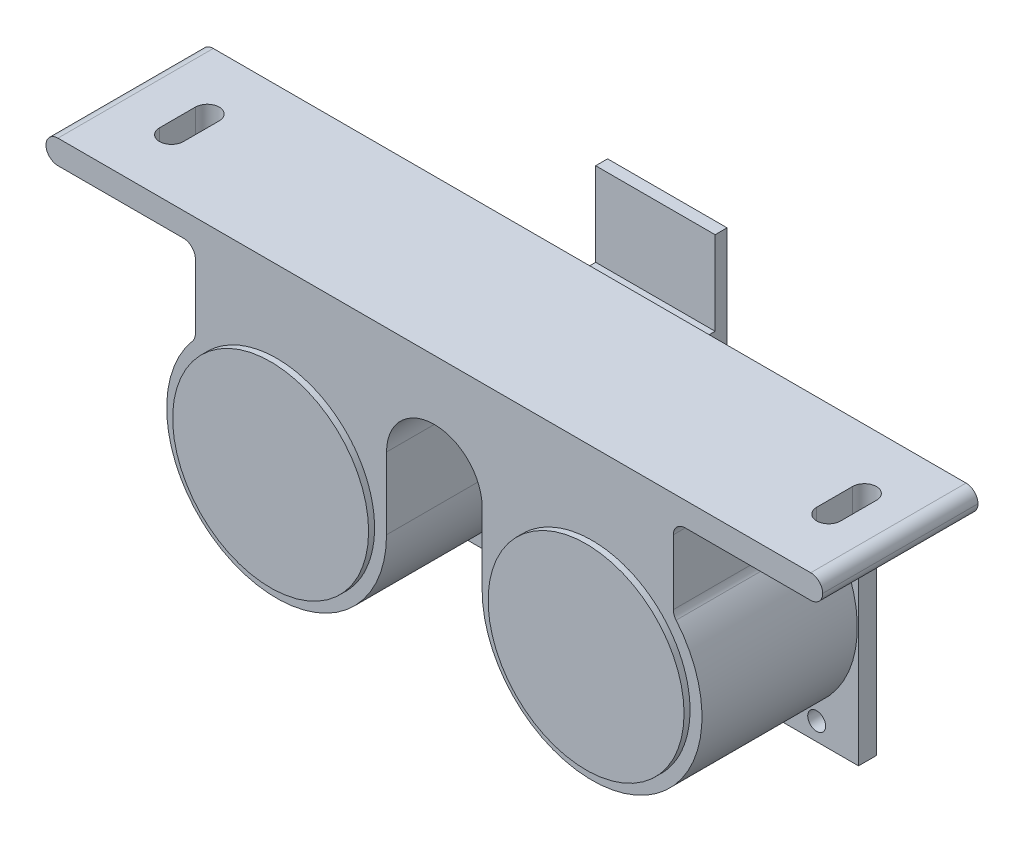
from build123d import *

# Parameters (mm, degrees)
SKETCH1_W           = 45
SKETCH1_H           = 20
SKETCH1_R           = 0.75
BOSS_EXTRUDE1_DEPTH = 1.5
SKETCH1_3_R         = 8.2
BOSS_EXTRUDE2_DEPTH = 13.5
SKETCH2_W           = 5
SKETCH2_H           = 4
SKETCH2_H_2         = 1
BOSS_EXTRUDE3_DEPTH = 3
SKETCH2_3_W         = 5
SKETCH2_3_H         = 1
BOSS_EXTRUDE4_DEPTH = 7
SKETCH4_R           = 8.2
BOSS_EXTRUDE5_DEPTH = 13
CUT_EXTRUDE1_DEPTH  = 2
FILLET1_R           = 1


with BuildPart() as part:
    # Sketch1 → Boss-Extrude1 (new body)
    with BuildSketch(Plane.XY):
        with Locations((22.5, 10)):
            Rectangle(SKETCH1_W, SKETCH1_H)
        with Locations((1.5, 1.5)):
            Circle(SKETCH1_R, mode=Mode.SUBTRACT)
        with Locations((1.5, 18.5)):
            Circle(SKETCH1_R, mode=Mode.SUBTRACT)
        with Locations((41.5, 18.5)):
            Circle(SKETCH1_R, mode=Mode.SUBTRACT)
        with Locations((41.5, 1.5)):
            Circle(SKETCH1_R, mode=Mode.SUBTRACT)
    extrude(amount=-BOSS_EXTRUDE1_DEPTH)

    # Sketch1<3> → Boss-Extrude2 (add)
    with BuildSketch(Plane.XY):
        with Locations((9.3, 10)):
            Circle(SKETCH1_3_R)
        with Locations((35.7, 10)):
            Circle(SKETCH1_3_R)
    extrude(amount=BOSS_EXTRUDE2_DEPTH)

    # Sketch2 → Boss-Extrude3 (add)
    with BuildSketch(Plane(origin=(0, 20, 0), x_dir=(1, 0, 0), z_dir=(0, 1, 0))):
        with Locations((25, 3.5)):
            Rectangle(SKETCH2_W, SKETCH2_H)
        with Locations((20, 3.5)):
            Rectangle(SKETCH2_W, SKETCH2_H)
        with Locations((20, 6)):
            Rectangle(SKETCH2_W, SKETCH2_H_2)
        with Locations((25, 6)):
            Rectangle(SKETCH2_W, SKETCH2_H_2)
    extrude(amount=-BOSS_EXTRUDE3_DEPTH)

    # Sketch2<3> → Boss-Extrude4 (add)
    with BuildSketch(Plane(origin=(0, 20, 0), x_dir=(1, 0, 0), z_dir=(0, 1, 0))):
        with Locations((25, 6)):
            Rectangle(SKETCH2_3_W, SKETCH2_3_H)
        with Locations((20, 6)):
            Rectangle(SKETCH2_3_W, SKETCH2_3_H)
    extrude(amount=BOSS_EXTRUDE4_DEPTH)


with BuildPart() as body_2:
    # Sketch4 → Boss-Extrude5 (new body)
    with BuildSketch(Plane.XY):
        with BuildLine():
            Line((18.5, 10), (18.5, 16))
            ThreePointArc((18.5, 16), (22.5, 20), (26.5, 16))
            Line((26.5, 16), (26.5, 10))
            ThreePointArc((26.5, 10), (39.022649545, 1.420955764), (42.5, 16.196773354))
            Line((42.5, 16.196773354), (42.5, 23))
            Line((42.5, 23), (55, 23))
            Line((55, 23), (55, 25))
            Line((55, 25), (-10, 25))
            Line((-10, 25), (-10, 23))
            Line((-10, 23), (2.5, 23))
            Line((2.5, 23), (2.5, 16.196773354))
            ThreePointArc((2.5, 16.196773354), (5.977350455, 1.420955764), (18.5, 10))
        make_face()
        with Locations(Location((35.7, 10, 0), (0, 0, 180))):
            Circle(SKETCH4_R, mode=Mode.SUBTRACT)
        with Locations(Location((9.3, 10, 0), (0, 0, 180))):
            Circle(SKETCH4_R, mode=Mode.SUBTRACT)
    extrude(amount=BOSS_EXTRUDE5_DEPTH)

    # Sketch5 → Cut-Extrude1 (cut)
    with BuildSketch(Plane(origin=(0, 25, 0), x_dir=(1, 0, 0), z_dir=(0, 1, 0))):
        with BuildLine():
            Line((-3.5, -5), (-3.5, -8))
            ThreePointArc((-3.5, -8), (-4.5, -9), (-5.5, -8))
            Line((-5.5, -8), (-5.5, -5))
            ThreePointArc((-5.5, -5), (-4.5, -4), (-3.5, -5))
        make_face()
        with BuildLine():
            Line((51.5, -5), (51.5, -8))
            ThreePointArc((51.5, -8), (50.5, -9), (49.5, -8))
            Line((49.5, -8), (49.5, -5))
            ThreePointArc((49.5, -5), (50.5, -4), (51.5, -5))
        make_face()
    extrude(amount=-CUT_EXTRUDE1_DEPTH, mode=Mode.SUBTRACT)

    # Fillet1
    fillet1_edges = [body_2.edges().sort_by_distance(p)[0] for p in [
        (55, 25, 6.5),
        (-10, 25, 6.5),
        (42.5, 16.196773354, 6.5),
        (2.5, 16.196773354, 6.5),
        (42.5, 23, 6.5),
        (55, 23, 6.5),
        (2.5, 23, 6.5),
        (-10, 23, 6.5),
    ]]
    fillet(fillet1_edges, radius=FILLET1_R - 0.0001)  # a hair under: the kernel refuses the full size


solid = Compound([part.part, body_2.part])
